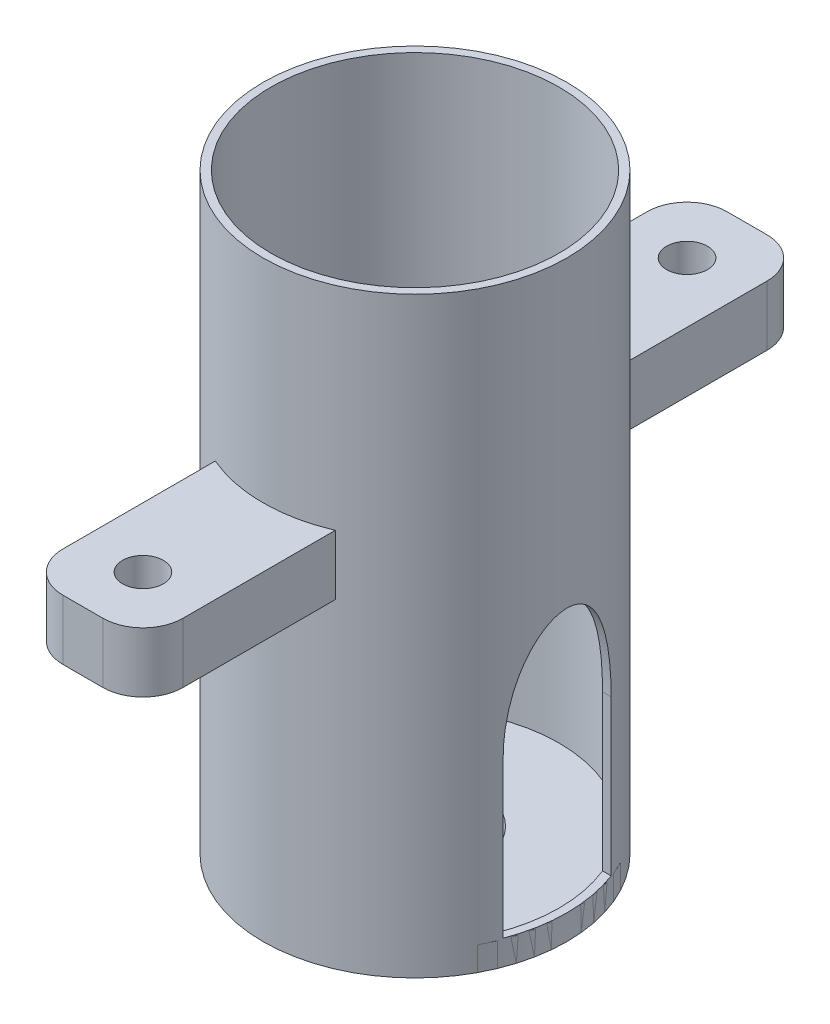
from build123d import *

# Parameters (mm, degrees)
SKETCH1_R             = 19
SKETCH1_R_2           = 2.75
SKETCH1_R_3           = 8
BOSS_EXTRUDE1_DEPTH   = 3
SKETCH1_5_R           = 19
SKETCH1_5_R_2         = 18
BOSS_EXTRUDE2_DEPTH   = 74
CUT_EXTRUDE1_DEPTH    = 79.727377703
SKETCH3_R             = 2.55
BOSS_EXTRUDE3_DEPTH   = 7.5
BOSS_EXTRUDE3_2_DEPTH = 7.5
BODY_MOVE_COPY1_ANGLE = 90
FILLET3_R             = 5
FILLET4_R             = 5


with BuildPart() as part:
    # Sketch1 → Boss-Extrude1 (new body)
    with BuildSketch(Plane(origin=(0, 0, 0), x_dir=(1, 0, 0), z_dir=(0, 1, 0))):
        with Locations(Location((0, 0, 0), (0, 0, 270))):
            Circle(SKETCH1_R)
        with Locations(Location((-12.55625, 0, 0), (0, 0, 270))):
            Circle(SKETCH1_R_2, mode=Mode.SUBTRACT)
        with Locations(Location((0, 0, 0), (0, 0, 270))):
            Circle(SKETCH1_R_3, mode=Mode.SUBTRACT)
    extrude(amount=BOSS_EXTRUDE1_DEPTH)


with BuildPart() as body_2:
    # Sketch1<5> → Boss-Extrude2 (new body)
    with BuildSketch(Plane(origin=(0, 0, 0), x_dir=(1, 0, 0), z_dir=(0, 1, 0))):
        with Locations(Location((0, 0, 0), (0, 0, 270))):
            Circle(SKETCH1_5_R)
        with Locations(Location((0, 0, 0), (0, 0, 270))):
            Circle(SKETCH1_5_R_2, mode=Mode.SUBTRACT)
    extrude(amount=BOSS_EXTRUDE2_DEPTH)

    # Sketch2 → Cut-Extrude1 (cut, through all)
    with BuildSketch(Plane(origin=(0, 0, 0), x_dir=(0, 0, -1), z_dir=(1, 0, 0))):
        with BuildLine():
            Line((-6.75, 22.5), (-6.75, 3.126681013))
            Line((-6.75, 3.126681013), (6.75, 3.126681013))
            Line((6.75, 3.126681013), (6.75, 22.5))
            add(Edge.make_bspline(
                [(6.75, 22.5), (6.75, 36.102227394), (0, 36.102227394), (-6.75, 36.102227394), (-6.75, 22.5)],
                knots=[4.71238898, 4.71238898, 4.71238898, 6.283185307, 6.283185307, 7.853981634, 7.853981634, 7.853981634], degree=2, weights=[1, 0.707106781, 1, 0.707106781, 1]))
        make_face()
    extrude(amount=CUT_EXTRUDE1_DEPTH, mode=Mode.SUBTRACT)


with BuildPart() as body_3:
    # Sketch3 → Boss-Extrude3 (new body)
    with BuildSketch(Plane(origin=(0, 40, 0), x_dir=(1, 0, 0), z_dir=(0, 1, 0))):
        with BuildLine():
            Line((-7.5, 41.5), (-7.5, 17.45709025))
            ThreePointArc((-7.5, 17.45709025), (0, 19), (7.5, 17.45709025))
            Line((7.5, 17.45709025), (7.5, 41.5))
            Line((7.5, 41.5), (-7.5, 41.5))
        make_face()
        with Locations(Location((0, 34, 0), (0, 0, 270))):
            Circle(SKETCH3_R, mode=Mode.SUBTRACT)
    extrude(amount=BOSS_EXTRUDE3_DEPTH)

    # Fillet4
    fillet4_edges = [body_3.edges().sort_by_distance(p)[0] for p in [
        (-7.5, 43.75, -41.5),
        (7.5, 43.75, -41.5),
    ]]
    fillet(fillet4_edges, radius=FILLET4_R)


with BuildPart() as body_4:
    # Sketch3 → Boss-Extrude3 2 (new body)
    with BuildSketch(Plane(origin=(0, 40, 0), x_dir=(1, 0, 0), z_dir=(0, 1, 0))):
        with BuildLine():
            ThreePointArc((7.5, -17.45709025), (0, -19), (-7.5, -17.45709025))
            Line((-7.5, -17.45709025), (-7.5, -41.5))
            Line((-7.5, -41.5), (7.5, -41.5))
            Line((7.5, -41.5), (7.5, -17.45709025))
        make_face()
        with Locations(Location((0, -34, 0), (0, 0, 270))):
            Circle(SKETCH3_R, mode=Mode.SUBTRACT)
    extrude(amount=BOSS_EXTRUDE3_2_DEPTH)

    # Fillet3
    fillet3_edges = [body_4.edges().sort_by_distance(p)[0] for p in [
        (7.5, 43.75, 41.5),
        (-7.5, 43.75, 41.5),
    ]]
    fillet(fillet3_edges, radius=FILLET3_R)


with BuildPart() as body_5:
    # barbfitting_mcmaster5218K688_V6: read off the stored shape, not the designer's step
    # barbfitting_mcmaster5218K688_V6 outline → barbfitting_mcmaster5218K688_V6 (revolve)
    with BuildSketch(Plane(origin=(-6.358056722, 31.008138883, 0), x_dir=(1, 0, 0), z_dir=(0, -1, 0))):
        Polygon((2.988629913, 1.192484738), (2.5, 1.192484738), (2.5, -8.050028229), (3.474601768, -8.050028229), (3.106067413, -3.407296512), (3.406067413, -3.407296512), align=None)
    revolve(axis=Axis((-6.358056722, 31.008138883, 0), (0, 0, 1)))


with BuildPart() as body_5_1:
    # Body-Move/Copy1: moved
    add(body_5.part.rotate(Axis((0, 31.008138883, -3.428771746), (-1, 0, 0)), BODY_MOVE_COPY1_ANGLE))


with BuildPart() as body_5_2:
    # Body-Move/Copy2: read off the stored shape, not the designer's step
    # Body-Move/Copy2: moved
    add(body_5_1.part.moved(Location((-6.1981933, -23.3868824, 3.4287717))))


solid = Compound([part.part, body_2.part, body_3.part, body_4.part, body_5_2.part])
